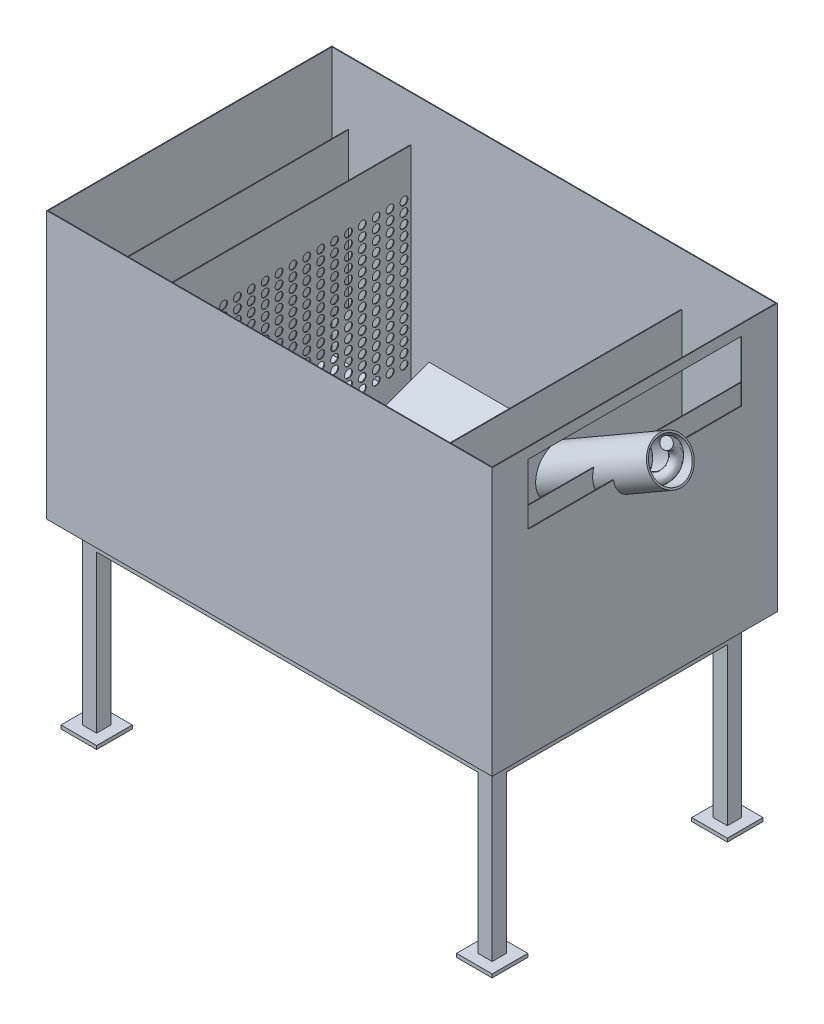
from build123d import *

# Parameters (mm, degrees)
MASTER_FOOTPRINT_W                       = 1250
MASTER_FOOTPRINT_H                       = 800.0000000000001
BATH_BASE_PLATE_DEPTH                    = 750
BATH_SHELL_2MM_T                         = -2
SKETCH_1_R                               = 50.00000000000001
INLET_D100_OPENING_DEPTH                 = 10
INLET_IMPACT_BAFFLE_START                = 125
SKETCH_2_W                               = 640.0000000000001
SKETCH_2_H                               = 430
INLET_IMPACT_BAFFLE_DEPTH                = 2
DISTRIBUTOR_D22_START                    = 250
SKETCH_3_W                               = 740
SKETCH_3_H                               = 648
SKETCH_3_R                               = 11.000000000000004
SKETCH_3_R_2                             = 10.999999999999996
SKETCH_3_R_3                             = 11.00000000000001
DISTRIBUTOR_D22_DEPTH                    = 2
OUTLET_SUBMERGED_BAFFLE_START            = 1030
SKETCH_4_W                               = 700
SKETCH_4_H                               = 330
OUTLET_SUBMERGED_BAFFLE_DEPTH            = 2
OVERFLOW_WEIR_Z550_START                 = 1190
SKETCH_5_W                               = 790.0000000000001
SKETCH_5_H                               = 548
OVERFLOW_WEIR_Z550_DEPTH                 = 2
OUTLET_WEIR_SLOT_W600_START              = 1245
SKETCH_6_W                               = 600
SKETCH_6_H                               = 170
OUTLET_WEIR_SLOT_W600_DEPTH              = 10
SLOPED_SEDIMENT_FLOOR_START              = 275
SLOPED_SEDIMENT_FLOOR_DEPTH              = 725
SKETCH_8_W                               = 39.99999999999999
SKETCH_8_H                               = 39.99999999999999
SKETCH_8_H_2                             = 39.999999999999886
SKETCH_8_W_2                             = 40
FRAME_LEGS_40X40_H500_DEPTH              = 500
FRAME_LONGITUDINAL_RAILS_START           = -20
SKETCH_9_W                               = 1150
SKETCH_9_H                               = 39.99999999999999
SKETCH_9_H_2                             = 39.999999999999886
FRAME_LONGITUDINAL_RAILS_DEPTH           = 40
FRAME_TRANSVERSE_RAILS_START             = -20
SKETCH_10_W                              = 39.99999999999999
SKETCH_10_H                              = 620.0000000000001
SKETCH_10_W_2                            = 40
FRAME_TRANSVERSE_RAILS_DEPTH             = 40
FRAME_FOOT_PADS_100X100_START            = -500
SKETCH_11_W                              = 100.00000000000001
SKETCH_11_H                              = 100.00000000000001
SKETCH_11_H_2                            = 100
SKETCH_11_W_2                            = 100
FRAME_FOOT_PADS_100X100_DEPTH            = 10
SCREW_PASSAGE_D120_PROFILE_R             = 60
SCREW_CASING_ID110_T5_PROFILE_R          = 60
SCREW_CASING_ID110_T5_PROFILE_R_2        = 55
SHAFTLESS_ROUND_COIL_D100_P100_PROFILE_R = 15


with BuildPart() as part:
    # MASTER_FOOTPRINT → BATH_BASE_PLATE (new body)
    with BuildSketch(Plane(origin=(0, 0, 0), x_dir=(1, 0, 0), z_dir=(0, 1, 0))):
        with Locations((625, 400.00000000000006)):
            Rectangle(MASTER_FOOTPRINT_W, MASTER_FOOTPRINT_H)
    extrude(amount=BATH_BASE_PLATE_DEPTH)

    # BATH_SHELL_2MM
    bath_shell_2mm_openings = [part.faces().sort_by_distance(p)[0] for p in [
        (625, 750, -400),
    ]]
    offset(amount=BATH_SHELL_2MM_T, openings=bath_shell_2mm_openings, kind=Kind.INTERSECTION)

    # Эскиз1 → INLET_D100_OPENING (cut)
    with BuildSketch(Plane(origin=(0, 0, 0), x_dir=(0, 0, -1), z_dir=(1, 0, 0))):
        with Locations((400, 420)):
            Circle(SKETCH_1_R)
    extrude(amount=INLET_D100_OPENING_DEPTH, mode=Mode.SUBTRACT)

    # Эскиз6 → OUTLET_WEIR_SLOT_W600 (cut)
    with BuildSketch(Plane(origin=(0, 0, 0), x_dir=(0, 0, -1), z_dir=(1, 0, 0)).offset(OUTLET_WEIR_SLOT_W600_START)):
        with Locations((400, 635)):
            Rectangle(SKETCH_6_W, SKETCH_6_H)
    extrude(amount=OUTLET_WEIR_SLOT_W600_DEPTH, mode=Mode.SUBTRACT)

    # Эскиз7 → SLOPED_SEDIMENT_FLOOR (add)
    with BuildSketch(Plane(origin=(0, 0, 0), x_dir=(0, 0, -1), z_dir=(1, 0, 0)).offset(SLOPED_SEDIMENT_FLOOR_START)):
        Polygon((2, -1), (2, 120), (330, -1), align=None)
        Polygon((798, -1), (798, 120), (470.00000000000006, -1), align=None)
    extrude(amount=SLOPED_SEDIMENT_FLOOR_DEPTH)

    # Эскиз8 → FRAME_LEGS_40X40_H500 (add)
    with BuildSketch(Plane(origin=(0, 0, 0), x_dir=(1, 0, 0), z_dir=(0, 1, 0))):
        with Locations((70, 70)):
            Rectangle(SKETCH_8_W, SKETCH_8_H)
        with Locations((70, 730)):
            Rectangle(SKETCH_8_W, SKETCH_8_H_2)
        with Locations((1180, 70)):
            Rectangle(SKETCH_8_W_2, SKETCH_8_H)
        with Locations((1180, 730)):
            Rectangle(SKETCH_8_W_2, SKETCH_8_H_2)
    extrude(amount=-FRAME_LEGS_40X40_H500_DEPTH)

    # Эскиз9 → FRAME_LONGITUDINAL_RAILS (add)
    with BuildSketch(Plane(origin=(0, 0, 0), x_dir=(1, 0, 0), z_dir=(0, 1, 0)).offset(FRAME_LONGITUDINAL_RAILS_START)):
        with Locations((625, 70)):
            Rectangle(SKETCH_9_W, SKETCH_9_H)
        with Locations((625, 730)):
            Rectangle(SKETCH_9_W, SKETCH_9_H_2)
    extrude(amount=-FRAME_LONGITUDINAL_RAILS_DEPTH)

    # Эскиз10 → FRAME_TRANSVERSE_RAILS (add)
    with BuildSketch(Plane(origin=(0, 0, 0), x_dir=(1, 0, 0), z_dir=(0, 1, 0)).offset(FRAME_TRANSVERSE_RAILS_START)):
        with Locations((70, 400.00000000000006)):
            Rectangle(SKETCH_10_W, SKETCH_10_H)
        with Locations((1180, 400.00000000000006)):
            Rectangle(SKETCH_10_W_2, SKETCH_10_H)
    extrude(amount=-FRAME_TRANSVERSE_RAILS_DEPTH)

    # Эскиз11 → FRAME_FOOT_PADS_100X100 (add)
    with BuildSketch(Plane(origin=(0, 0, 0), x_dir=(1, 0, 0), z_dir=(0, 1, 0)).offset(FRAME_FOOT_PADS_100X100_START)):
        with Locations((70, 70)):
            Rectangle(SKETCH_11_W, SKETCH_11_H)
        with Locations((70, 730)):
            Rectangle(SKETCH_11_W, SKETCH_11_H_2)
        with Locations((1180, 70)):
            Rectangle(SKETCH_11_W_2, SKETCH_11_H)
        with Locations((1180, 730)):
            Rectangle(SKETCH_11_W_2, SKETCH_11_H_2)
    extrude(amount=-FRAME_FOOT_PADS_100X100_DEPTH)


with BuildPart() as body_2:
    # Эскиз2 → INLET_IMPACT_BAFFLE (new body)
    with BuildSketch(Plane(origin=(0, 0, 0), x_dir=(0, 0, -1), z_dir=(1, 0, 0)).offset(INLET_IMPACT_BAFFLE_START)):
        with Locations((400.00000000000006, 435)):
            Rectangle(SKETCH_2_W, SKETCH_2_H)
    extrude(amount=INLET_IMPACT_BAFFLE_DEPTH)


with BuildPart() as body_3:
    # Эскиз3 → DISTRIBUTOR_D22 (new body)
    with BuildSketch(Plane(origin=(0, 0, 0), x_dir=(0, 0, -1), z_dir=(1, 0, 0)).offset(DISTRIBUTOR_D22_START)):
        with Locations((400, 326)):
            Rectangle(SKETCH_3_W, SKETCH_3_H)
        with Locations((49.473684210526315, 125)):
            Circle(SKETCH_3_R, mode=Mode.SUBTRACT)
        with Locations((49.473684210526315, 153.5)):
            Circle(SKETCH_3_R, mode=Mode.SUBTRACT)
        with Locations((49.473684210526315, 182)):
            Circle(SKETCH_3_R, mode=Mode.SUBTRACT)
        with Locations((49.473684210526315, 210.50000000000003)):
            Circle(SKETCH_3_R, mode=Mode.SUBTRACT)
        with Locations((49.473684210526315, 239)):
            Circle(SKETCH_3_R, mode=Mode.SUBTRACT)
        with Locations((49.473684210526315, 267.5)):
            Circle(SKETCH_3_R, mode=Mode.SUBTRACT)
        with Locations((49.473684210526315, 296.00000000000006)):
            Circle(SKETCH_3_R, mode=Mode.SUBTRACT)
        with Locations((49.473684210526315, 324.5)):
            Circle(SKETCH_3_R, mode=Mode.SUBTRACT)
        with Locations((49.473684210526315, 353)):
            Circle(SKETCH_3_R, mode=Mode.SUBTRACT)
        with Locations((49.473684210526315, 381.5)):
            Circle(SKETCH_3_R, mode=Mode.SUBTRACT)
        with Locations((49.473684210526315, 410.00000000000006)):
            Circle(SKETCH_3_R, mode=Mode.SUBTRACT)
        with Locations((49.473684210526315, 438.5)):
            Circle(SKETCH_3_R, mode=Mode.SUBTRACT)
        with Locations((49.473684210526315, 467)):
            Circle(SKETCH_3_R, mode=Mode.SUBTRACT)
        with Locations((49.473684210526315, 495.5)):
            Circle(SKETCH_3_R, mode=Mode.SUBTRACT)
        with Locations((49.473684210526315, 524)):
            Circle(SKETCH_3_R, mode=Mode.SUBTRACT)
        with Locations((88.42105263157895, 125)):
            Circle(SKETCH_3_R_2, mode=Mode.SUBTRACT)
        with Locations((88.42105263157895, 153.5)):
            Circle(SKETCH_3_R_2, mode=Mode.SUBTRACT)
        with Locations((88.42105263157895, 182)):
            Circle(SKETCH_3_R_2, mode=Mode.SUBTRACT)
        with Locations((88.42105263157895, 210.50000000000003)):
            Circle(SKETCH_3_R_2, mode=Mode.SUBTRACT)
        with Locations((88.42105263157895, 239)):
            Circle(SKETCH_3_R_2, mode=Mode.SUBTRACT)
        with Locations((88.42105263157895, 267.5)):
            Circle(SKETCH_3_R_2, mode=Mode.SUBTRACT)
        with Locations((88.42105263157895, 296.00000000000006)):
            Circle(SKETCH_3_R_2, mode=Mode.SUBTRACT)
        with Locations((88.42105263157895, 324.5)):
            Circle(SKETCH_3_R_2, mode=Mode.SUBTRACT)
        with Locations((88.42105263157895, 353)):
            Circle(SKETCH_3_R_2, mode=Mode.SUBTRACT)
        with Locations((88.42105263157895, 381.5)):
            Circle(SKETCH_3_R_2, mode=Mode.SUBTRACT)
        with Locations((88.42105263157895, 410.00000000000006)):
            Circle(SKETCH_3_R_2, mode=Mode.SUBTRACT)
        with Locations((88.42105263157895, 438.5)):
            Circle(SKETCH_3_R_2, mode=Mode.SUBTRACT)
        with Locations((88.42105263157895, 467)):
            Circle(SKETCH_3_R_2, mode=Mode.SUBTRACT)
        with Locations((88.42105263157895, 495.5)):
            Circle(SKETCH_3_R_2, mode=Mode.SUBTRACT)
        with Locations((88.42105263157895, 524)):
            Circle(SKETCH_3_R_2, mode=Mode.SUBTRACT)
        with Locations((127.36842105263158, 125)):
            Circle(SKETCH_3_R_3, mode=Mode.SUBTRACT)
        with Locations((127.36842105263158, 153.5)):
            Circle(SKETCH_3_R_3, mode=Mode.SUBTRACT)
        with Locations((127.36842105263158, 182)):
            Circle(SKETCH_3_R_3, mode=Mode.SUBTRACT)
        with Locations((127.36842105263158, 210.50000000000003)):
            Circle(SKETCH_3_R_3, mode=Mode.SUBTRACT)
        with Locations((127.36842105263158, 239)):
            Circle(SKETCH_3_R_3, mode=Mode.SUBTRACT)
        with Locations((127.36842105263158, 267.5)):
            Circle(SKETCH_3_R_3, mode=Mode.SUBTRACT)
        with Locations((127.36842105263158, 296.00000000000006)):
            Circle(SKETCH_3_R_3, mode=Mode.SUBTRACT)
        with Locations((127.36842105263158, 324.5)):
            Circle(SKETCH_3_R_3, mode=Mode.SUBTRACT)
        with Locations((127.36842105263158, 353)):
            Circle(SKETCH_3_R_3, mode=Mode.SUBTRACT)
        with Locations((127.36842105263158, 381.5)):
            Circle(SKETCH_3_R_3, mode=Mode.SUBTRACT)
        with Locations((127.36842105263158, 410.00000000000006)):
            Circle(SKETCH_3_R_3, mode=Mode.SUBTRACT)
        with Locations((127.36842105263158, 438.5)):
            Circle(SKETCH_3_R_3, mode=Mode.SUBTRACT)
        with Locations((127.36842105263158, 467)):
            Circle(SKETCH_3_R_3, mode=Mode.SUBTRACT)
        with Locations((127.36842105263158, 495.5)):
            Circle(SKETCH_3_R_3, mode=Mode.SUBTRACT)
        with Locations((127.36842105263158, 524)):
            Circle(SKETCH_3_R_3, mode=Mode.SUBTRACT)
        with Locations((166.3157894736842, 125)):
            Circle(SKETCH_3_R_3, mode=Mode.SUBTRACT)
        with Locations((166.3157894736842, 153.5)):
            Circle(SKETCH_3_R_3, mode=Mode.SUBTRACT)
        with Locations((166.3157894736842, 182)):
            Circle(SKETCH_3_R_3, mode=Mode.SUBTRACT)
        with Locations((166.3157894736842, 210.50000000000003)):
            Circle(SKETCH_3_R_3, mode=Mode.SUBTRACT)
        with Locations((166.3157894736842, 239)):
            Circle(SKETCH_3_R_3, mode=Mode.SUBTRACT)
        with Locations((166.3157894736842, 267.5)):
            Circle(SKETCH_3_R_3, mode=Mode.SUBTRACT)
        with Locations((166.3157894736842, 296.00000000000006)):
            Circle(SKETCH_3_R_3, mode=Mode.SUBTRACT)
        with Locations((166.3157894736842, 324.5)):
            Circle(SKETCH_3_R_3, mode=Mode.SUBTRACT)
        with Locations((166.3157894736842, 353)):
            Circle(SKETCH_3_R_3, mode=Mode.SUBTRACT)
        with Locations((166.3157894736842, 381.5)):
            Circle(SKETCH_3_R_3, mode=Mode.SUBTRACT)
        with Locations((166.3157894736842, 410.00000000000006)):
            Circle(SKETCH_3_R_3, mode=Mode.SUBTRACT)
        with Locations((166.3157894736842, 438.5)):
            Circle(SKETCH_3_R_3, mode=Mode.SUBTRACT)
        with Locations((166.3157894736842, 467)):
            Circle(SKETCH_3_R_3, mode=Mode.SUBTRACT)
        with Locations((166.3157894736842, 495.5)):
            Circle(SKETCH_3_R_3, mode=Mode.SUBTRACT)
        with Locations((166.3157894736842, 524)):
            Circle(SKETCH_3_R_3, mode=Mode.SUBTRACT)
        with Locations((205.26315789473685, 125)):
            Circle(SKETCH_3_R_3, mode=Mode.SUBTRACT)
        with Locations((205.26315789473685, 153.5)):
            Circle(SKETCH_3_R_3, mode=Mode.SUBTRACT)
        with Locations((205.26315789473685, 182)):
            Circle(SKETCH_3_R_3, mode=Mode.SUBTRACT)
        with Locations((205.26315789473685, 210.50000000000003)):
            Circle(SKETCH_3_R_3, mode=Mode.SUBTRACT)
        with Locations((205.26315789473685, 239)):
            Circle(SKETCH_3_R_3, mode=Mode.SUBTRACT)
        with Locations((205.26315789473685, 267.5)):
            Circle(SKETCH_3_R_3, mode=Mode.SUBTRACT)
        with Locations((205.26315789473685, 296.00000000000006)):
            Circle(SKETCH_3_R_3, mode=Mode.SUBTRACT)
        with Locations((205.26315789473685, 324.5)):
            Circle(SKETCH_3_R_3, mode=Mode.SUBTRACT)
        with Locations((205.26315789473685, 353)):
            Circle(SKETCH_3_R_3, mode=Mode.SUBTRACT)
        with Locations((205.26315789473685, 381.5)):
            Circle(SKETCH_3_R_3, mode=Mode.SUBTRACT)
        with Locations((205.26315789473685, 410.00000000000006)):
            Circle(SKETCH_3_R_3, mode=Mode.SUBTRACT)
        with Locations((205.26315789473685, 438.5)):
            Circle(SKETCH_3_R_3, mode=Mode.SUBTRACT)
        with Locations((205.26315789473685, 467)):
            Circle(SKETCH_3_R_3, mode=Mode.SUBTRACT)
        with Locations((205.26315789473685, 495.5)):
            Circle(SKETCH_3_R_3, mode=Mode.SUBTRACT)
        with Locations((205.26315789473685, 524)):
            Circle(SKETCH_3_R_3, mode=Mode.SUBTRACT)
        with Locations((244.21052631578948, 125)):
            Circle(SKETCH_3_R_3, mode=Mode.SUBTRACT)
        with Locations((244.21052631578948, 153.5)):
            Circle(SKETCH_3_R_3, mode=Mode.SUBTRACT)
        with Locations((244.21052631578948, 182)):
            Circle(SKETCH_3_R_3, mode=Mode.SUBTRACT)
        with Locations((244.21052631578948, 210.50000000000003)):
            Circle(SKETCH_3_R_3, mode=Mode.SUBTRACT)
        with Locations((244.21052631578948, 239)):
            Circle(SKETCH_3_R_3, mode=Mode.SUBTRACT)
        with Locations((244.21052631578948, 267.5)):
            Circle(SKETCH_3_R_3, mode=Mode.SUBTRACT)
        with Locations((244.21052631578948, 296.00000000000006)):
            Circle(SKETCH_3_R_3, mode=Mode.SUBTRACT)
        with Locations((244.21052631578948, 324.5)):
            Circle(SKETCH_3_R_3, mode=Mode.SUBTRACT)
        with Locations((244.21052631578948, 353)):
            Circle(SKETCH_3_R_3, mode=Mode.SUBTRACT)
        with Locations((244.21052631578948, 381.5)):
            Circle(SKETCH_3_R_3, mode=Mode.SUBTRACT)
        with Locations((244.21052631578948, 410.00000000000006)):
            Circle(SKETCH_3_R_3, mode=Mode.SUBTRACT)
        with Locations((244.21052631578948, 438.5)):
            Circle(SKETCH_3_R_3, mode=Mode.SUBTRACT)
        with Locations((244.21052631578948, 467)):
            Circle(SKETCH_3_R_3, mode=Mode.SUBTRACT)
        with Locations((244.21052631578948, 495.5)):
            Circle(SKETCH_3_R_3, mode=Mode.SUBTRACT)
        with Locations((244.21052631578948, 524)):
            Circle(SKETCH_3_R_3, mode=Mode.SUBTRACT)
        with Locations((283.1578947368421, 125)):
            Circle(SKETCH_3_R_3, mode=Mode.SUBTRACT)
        with Locations((283.1578947368421, 153.5)):
            Circle(SKETCH_3_R_3, mode=Mode.SUBTRACT)
        with Locations((283.1578947368421, 182)):
            Circle(SKETCH_3_R_3, mode=Mode.SUBTRACT)
        with Locations((283.1578947368421, 210.50000000000003)):
            Circle(SKETCH_3_R_3, mode=Mode.SUBTRACT)
        with Locations((283.1578947368421, 239)):
            Circle(SKETCH_3_R_3, mode=Mode.SUBTRACT)
        with Locations((283.1578947368421, 267.5)):
            Circle(SKETCH_3_R_3, mode=Mode.SUBTRACT)
        with Locations((283.1578947368421, 296.00000000000006)):
            Circle(SKETCH_3_R_3, mode=Mode.SUBTRACT)
        with Locations((283.1578947368421, 324.5)):
            Circle(SKETCH_3_R_3, mode=Mode.SUBTRACT)
        with Locations((283.1578947368421, 353)):
            Circle(SKETCH_3_R_3, mode=Mode.SUBTRACT)
        with Locations((283.1578947368421, 381.5)):
            Circle(SKETCH_3_R_3, mode=Mode.SUBTRACT)
        with Locations((283.1578947368421, 410.00000000000006)):
            Circle(SKETCH_3_R_3, mode=Mode.SUBTRACT)
        with Locations((283.1578947368421, 438.5)):
            Circle(SKETCH_3_R_3, mode=Mode.SUBTRACT)
        with Locations((283.1578947368421, 467)):
            Circle(SKETCH_3_R_3, mode=Mode.SUBTRACT)
        with Locations((283.1578947368421, 495.5)):
            Circle(SKETCH_3_R_3, mode=Mode.SUBTRACT)
        with Locations((283.1578947368421, 524)):
            Circle(SKETCH_3_R_3, mode=Mode.SUBTRACT)
        with Locations((322.1052631578947, 125)):
            Circle(SKETCH_3_R_3, mode=Mode.SUBTRACT)
        with Locations((322.1052631578947, 153.5)):
            Circle(SKETCH_3_R_3, mode=Mode.SUBTRACT)
        with Locations((322.1052631578947, 182)):
            Circle(SKETCH_3_R_3, mode=Mode.SUBTRACT)
        with Locations((322.1052631578947, 210.50000000000003)):
            Circle(SKETCH_3_R_3, mode=Mode.SUBTRACT)
        with Locations((322.1052631578947, 239)):
            Circle(SKETCH_3_R_3, mode=Mode.SUBTRACT)
        with Locations((322.1052631578947, 267.5)):
            Circle(SKETCH_3_R_3, mode=Mode.SUBTRACT)
        with Locations((322.1052631578947, 296.00000000000006)):
            Circle(SKETCH_3_R_3, mode=Mode.SUBTRACT)
        with Locations((322.1052631578947, 324.5)):
            Circle(SKETCH_3_R_3, mode=Mode.SUBTRACT)
        with Locations((322.1052631578947, 353)):
            Circle(SKETCH_3_R_3, mode=Mode.SUBTRACT)
        with Locations((322.1052631578947, 381.5)):
            Circle(SKETCH_3_R_3, mode=Mode.SUBTRACT)
        with Locations((322.1052631578947, 410.00000000000006)):
            Circle(SKETCH_3_R_3, mode=Mode.SUBTRACT)
        with Locations((322.1052631578947, 438.5)):
            Circle(SKETCH_3_R_3, mode=Mode.SUBTRACT)
        with Locations((322.1052631578947, 467)):
            Circle(SKETCH_3_R_3, mode=Mode.SUBTRACT)
        with Locations((322.1052631578947, 495.5)):
            Circle(SKETCH_3_R_3, mode=Mode.SUBTRACT)
        with Locations((322.1052631578947, 524)):
            Circle(SKETCH_3_R_3, mode=Mode.SUBTRACT)
        with Locations((361.0526315789474, 125)):
            Circle(SKETCH_3_R_3, mode=Mode.SUBTRACT)
        with Locations((361.0526315789474, 153.5)):
            Circle(SKETCH_3_R_3, mode=Mode.SUBTRACT)
        with Locations((361.0526315789474, 182)):
            Circle(SKETCH_3_R_3, mode=Mode.SUBTRACT)
        with Locations((361.0526315789474, 210.50000000000003)):
            Circle(SKETCH_3_R_3, mode=Mode.SUBTRACT)
        with Locations((361.0526315789474, 239)):
            Circle(SKETCH_3_R_3, mode=Mode.SUBTRACT)
        with Locations((361.0526315789474, 267.5)):
            Circle(SKETCH_3_R_3, mode=Mode.SUBTRACT)
        with Locations((361.0526315789474, 296.00000000000006)):
            Circle(SKETCH_3_R_3, mode=Mode.SUBTRACT)
        with Locations((361.0526315789474, 324.5)):
            Circle(SKETCH_3_R_3, mode=Mode.SUBTRACT)
        with Locations((361.0526315789474, 353)):
            Circle(SKETCH_3_R_3, mode=Mode.SUBTRACT)
        with Locations((361.0526315789474, 381.5)):
            Circle(SKETCH_3_R_3, mode=Mode.SUBTRACT)
        with Locations((361.0526315789474, 410.00000000000006)):
            Circle(SKETCH_3_R_3, mode=Mode.SUBTRACT)
        with Locations((361.0526315789474, 438.5)):
            Circle(SKETCH_3_R_3, mode=Mode.SUBTRACT)
        with Locations((361.0526315789474, 467)):
            Circle(SKETCH_3_R_3, mode=Mode.SUBTRACT)
        with Locations((361.0526315789474, 495.5)):
            Circle(SKETCH_3_R_3, mode=Mode.SUBTRACT)
        with Locations((361.0526315789474, 524)):
            Circle(SKETCH_3_R_3, mode=Mode.SUBTRACT)
        with Locations((400, 125)):
            Circle(SKETCH_3_R_3, mode=Mode.SUBTRACT)
        with Locations((400, 153.5)):
            Circle(SKETCH_3_R_3, mode=Mode.SUBTRACT)
        with Locations((400, 182)):
            Circle(SKETCH_3_R_3, mode=Mode.SUBTRACT)
        with Locations((400, 210.50000000000003)):
            Circle(SKETCH_3_R_3, mode=Mode.SUBTRACT)
        with Locations((400, 239)):
            Circle(SKETCH_3_R_3, mode=Mode.SUBTRACT)
        with Locations((400, 267.5)):
            Circle(SKETCH_3_R_3, mode=Mode.SUBTRACT)
        with Locations((400, 296.00000000000006)):
            Circle(SKETCH_3_R_3, mode=Mode.SUBTRACT)
        with Locations((400, 324.5)):
            Circle(SKETCH_3_R_3, mode=Mode.SUBTRACT)
        with Locations((400, 353)):
            Circle(SKETCH_3_R_3, mode=Mode.SUBTRACT)
        with Locations((400, 381.5)):
            Circle(SKETCH_3_R_3, mode=Mode.SUBTRACT)
        with Locations((400, 410.00000000000006)):
            Circle(SKETCH_3_R_3, mode=Mode.SUBTRACT)
        with Locations((400, 438.5)):
            Circle(SKETCH_3_R_3, mode=Mode.SUBTRACT)
        with Locations((400, 467)):
            Circle(SKETCH_3_R_3, mode=Mode.SUBTRACT)
        with Locations((400, 495.5)):
            Circle(SKETCH_3_R_3, mode=Mode.SUBTRACT)
        with Locations((400, 524)):
            Circle(SKETCH_3_R_3, mode=Mode.SUBTRACT)
        with Locations((438.94736842105266, 125)):
            Circle(SKETCH_3_R_3, mode=Mode.SUBTRACT)
        with Locations((438.94736842105266, 153.5)):
            Circle(SKETCH_3_R_3, mode=Mode.SUBTRACT)
        with Locations((438.94736842105266, 182)):
            Circle(SKETCH_3_R_3, mode=Mode.SUBTRACT)
        with Locations((438.94736842105266, 210.50000000000003)):
            Circle(SKETCH_3_R_3, mode=Mode.SUBTRACT)
        with Locations((438.94736842105266, 239)):
            Circle(SKETCH_3_R_3, mode=Mode.SUBTRACT)
        with Locations((438.94736842105266, 267.5)):
            Circle(SKETCH_3_R_3, mode=Mode.SUBTRACT)
        with Locations((438.94736842105266, 296.00000000000006)):
            Circle(SKETCH_3_R_3, mode=Mode.SUBTRACT)
        with Locations((438.94736842105266, 324.5)):
            Circle(SKETCH_3_R_3, mode=Mode.SUBTRACT)
        with Locations((438.94736842105266, 353)):
            Circle(SKETCH_3_R_3, mode=Mode.SUBTRACT)
        with Locations((438.94736842105266, 381.5)):
            Circle(SKETCH_3_R_3, mode=Mode.SUBTRACT)
        with Locations((438.94736842105266, 410.00000000000006)):
            Circle(SKETCH_3_R_3, mode=Mode.SUBTRACT)
        with Locations((438.94736842105266, 438.5)):
            Circle(SKETCH_3_R_3, mode=Mode.SUBTRACT)
        with Locations((438.94736842105266, 467)):
            Circle(SKETCH_3_R_3, mode=Mode.SUBTRACT)
        with Locations((438.94736842105266, 495.5)):
            Circle(SKETCH_3_R_3, mode=Mode.SUBTRACT)
        with Locations((438.94736842105266, 524)):
            Circle(SKETCH_3_R_3, mode=Mode.SUBTRACT)
        with Locations((477.89473684210526, 125)):
            Circle(SKETCH_3_R_3, mode=Mode.SUBTRACT)
        with Locations((477.89473684210526, 153.5)):
            Circle(SKETCH_3_R_3, mode=Mode.SUBTRACT)
        with Locations((477.89473684210526, 182)):
            Circle(SKETCH_3_R_3, mode=Mode.SUBTRACT)
        with Locations((477.89473684210526, 210.50000000000003)):
            Circle(SKETCH_3_R_3, mode=Mode.SUBTRACT)
        with Locations((477.89473684210526, 239)):
            Circle(SKETCH_3_R_3, mode=Mode.SUBTRACT)
        with Locations((477.89473684210526, 267.5)):
            Circle(SKETCH_3_R_3, mode=Mode.SUBTRACT)
        with Locations((477.89473684210526, 296.00000000000006)):
            Circle(SKETCH_3_R_3, mode=Mode.SUBTRACT)
        with Locations((477.89473684210526, 324.5)):
            Circle(SKETCH_3_R_3, mode=Mode.SUBTRACT)
        with Locations((477.89473684210526, 353)):
            Circle(SKETCH_3_R_3, mode=Mode.SUBTRACT)
        with Locations((477.89473684210526, 381.5)):
            Circle(SKETCH_3_R_3, mode=Mode.SUBTRACT)
        with Locations((477.89473684210526, 410.00000000000006)):
            Circle(SKETCH_3_R_3, mode=Mode.SUBTRACT)
        with Locations((477.89473684210526, 438.5)):
            Circle(SKETCH_3_R_3, mode=Mode.SUBTRACT)
        with Locations((477.89473684210526, 467)):
            Circle(SKETCH_3_R_3, mode=Mode.SUBTRACT)
        with Locations((477.89473684210526, 495.5)):
            Circle(SKETCH_3_R_3, mode=Mode.SUBTRACT)
        with Locations((477.89473684210526, 524)):
            Circle(SKETCH_3_R_3, mode=Mode.SUBTRACT)
        with Locations((516.8421052631579, 125)):
            Circle(SKETCH_3_R_3, mode=Mode.SUBTRACT)
        with Locations((516.8421052631579, 153.5)):
            Circle(SKETCH_3_R_3, mode=Mode.SUBTRACT)
        with Locations((516.8421052631579, 182)):
            Circle(SKETCH_3_R_3, mode=Mode.SUBTRACT)
        with Locations((516.8421052631579, 210.50000000000003)):
            Circle(SKETCH_3_R_3, mode=Mode.SUBTRACT)
        with Locations((516.8421052631579, 239)):
            Circle(SKETCH_3_R_3, mode=Mode.SUBTRACT)
        with Locations((516.8421052631579, 267.5)):
            Circle(SKETCH_3_R_3, mode=Mode.SUBTRACT)
        with Locations((516.8421052631579, 296.00000000000006)):
            Circle(SKETCH_3_R_3, mode=Mode.SUBTRACT)
        with Locations((516.8421052631579, 324.5)):
            Circle(SKETCH_3_R_3, mode=Mode.SUBTRACT)
        with Locations((516.8421052631579, 353)):
            Circle(SKETCH_3_R_3, mode=Mode.SUBTRACT)
        with Locations((516.8421052631579, 381.5)):
            Circle(SKETCH_3_R_3, mode=Mode.SUBTRACT)
        with Locations((516.8421052631579, 410.00000000000006)):
            Circle(SKETCH_3_R_3, mode=Mode.SUBTRACT)
        with Locations((516.8421052631579, 438.5)):
            Circle(SKETCH_3_R_3, mode=Mode.SUBTRACT)
        with Locations((516.8421052631579, 467)):
            Circle(SKETCH_3_R_3, mode=Mode.SUBTRACT)
        with Locations((516.8421052631579, 495.5)):
            Circle(SKETCH_3_R_3, mode=Mode.SUBTRACT)
        with Locations((516.8421052631579, 524)):
            Circle(SKETCH_3_R_3, mode=Mode.SUBTRACT)
        with Locations((555.7894736842106, 125)):
            Circle(SKETCH_3_R_3, mode=Mode.SUBTRACT)
        with Locations((555.7894736842106, 153.5)):
            Circle(SKETCH_3_R_3, mode=Mode.SUBTRACT)
        with Locations((555.7894736842106, 182)):
            Circle(SKETCH_3_R_3, mode=Mode.SUBTRACT)
        with Locations((555.7894736842106, 210.50000000000003)):
            Circle(SKETCH_3_R_3, mode=Mode.SUBTRACT)
        with Locations((555.7894736842106, 239)):
            Circle(SKETCH_3_R_3, mode=Mode.SUBTRACT)
        with Locations((555.7894736842106, 267.5)):
            Circle(SKETCH_3_R_3, mode=Mode.SUBTRACT)
        with Locations((555.7894736842106, 296.00000000000006)):
            Circle(SKETCH_3_R_3, mode=Mode.SUBTRACT)
        with Locations((555.7894736842106, 324.5)):
            Circle(SKETCH_3_R_3, mode=Mode.SUBTRACT)
        with Locations((555.7894736842106, 353)):
            Circle(SKETCH_3_R_3, mode=Mode.SUBTRACT)
        with Locations((555.7894736842106, 381.5)):
            Circle(SKETCH_3_R_3, mode=Mode.SUBTRACT)
        with Locations((555.7894736842106, 410.00000000000006)):
            Circle(SKETCH_3_R_3, mode=Mode.SUBTRACT)
        with Locations((555.7894736842106, 438.5)):
            Circle(SKETCH_3_R_3, mode=Mode.SUBTRACT)
        with Locations((555.7894736842106, 467)):
            Circle(SKETCH_3_R_3, mode=Mode.SUBTRACT)
        with Locations((555.7894736842106, 495.5)):
            Circle(SKETCH_3_R_3, mode=Mode.SUBTRACT)
        with Locations((555.7894736842106, 524)):
            Circle(SKETCH_3_R_3, mode=Mode.SUBTRACT)
        with Locations((594.7368421052632, 125)):
            Circle(SKETCH_3_R_3, mode=Mode.SUBTRACT)
        with Locations((594.7368421052632, 153.5)):
            Circle(SKETCH_3_R_3, mode=Mode.SUBTRACT)
        with Locations((594.7368421052632, 182)):
            Circle(SKETCH_3_R_3, mode=Mode.SUBTRACT)
        with Locations((594.7368421052632, 210.50000000000003)):
            Circle(SKETCH_3_R_3, mode=Mode.SUBTRACT)
        with Locations((594.7368421052632, 239)):
            Circle(SKETCH_3_R_3, mode=Mode.SUBTRACT)
        with Locations((594.7368421052632, 267.5)):
            Circle(SKETCH_3_R_3, mode=Mode.SUBTRACT)
        with Locations((594.7368421052632, 296.00000000000006)):
            Circle(SKETCH_3_R_3, mode=Mode.SUBTRACT)
        with Locations((594.7368421052632, 324.5)):
            Circle(SKETCH_3_R_3, mode=Mode.SUBTRACT)
        with Locations((594.7368421052632, 353)):
            Circle(SKETCH_3_R_3, mode=Mode.SUBTRACT)
        with Locations((594.7368421052632, 381.5)):
            Circle(SKETCH_3_R_3, mode=Mode.SUBTRACT)
        with Locations((594.7368421052632, 410.00000000000006)):
            Circle(SKETCH_3_R_3, mode=Mode.SUBTRACT)
        with Locations((594.7368421052632, 438.5)):
            Circle(SKETCH_3_R_3, mode=Mode.SUBTRACT)
        with Locations((594.7368421052632, 467)):
            Circle(SKETCH_3_R_3, mode=Mode.SUBTRACT)
        with Locations((594.7368421052632, 495.5)):
            Circle(SKETCH_3_R_3, mode=Mode.SUBTRACT)
        with Locations((594.7368421052632, 524)):
            Circle(SKETCH_3_R_3, mode=Mode.SUBTRACT)
        with Locations((633.6842105263158, 125)):
            Circle(SKETCH_3_R_3, mode=Mode.SUBTRACT)
        with Locations((633.6842105263158, 153.5)):
            Circle(SKETCH_3_R_3, mode=Mode.SUBTRACT)
        with Locations((633.6842105263158, 182)):
            Circle(SKETCH_3_R_3, mode=Mode.SUBTRACT)
        with Locations((633.6842105263158, 210.50000000000003)):
            Circle(SKETCH_3_R_3, mode=Mode.SUBTRACT)
        with Locations((633.6842105263158, 239)):
            Circle(SKETCH_3_R_3, mode=Mode.SUBTRACT)
        with Locations((633.6842105263158, 267.5)):
            Circle(SKETCH_3_R_3, mode=Mode.SUBTRACT)
        with Locations((633.6842105263158, 296.00000000000006)):
            Circle(SKETCH_3_R_3, mode=Mode.SUBTRACT)
        with Locations((633.6842105263158, 324.5)):
            Circle(SKETCH_3_R_3, mode=Mode.SUBTRACT)
        with Locations((633.6842105263158, 353)):
            Circle(SKETCH_3_R_3, mode=Mode.SUBTRACT)
        with Locations((633.6842105263158, 381.5)):
            Circle(SKETCH_3_R_3, mode=Mode.SUBTRACT)
        with Locations((633.6842105263158, 410.00000000000006)):
            Circle(SKETCH_3_R_3, mode=Mode.SUBTRACT)
        with Locations((633.6842105263158, 438.5)):
            Circle(SKETCH_3_R_3, mode=Mode.SUBTRACT)
        with Locations((633.6842105263158, 467)):
            Circle(SKETCH_3_R_3, mode=Mode.SUBTRACT)
        with Locations((633.6842105263158, 495.5)):
            Circle(SKETCH_3_R_3, mode=Mode.SUBTRACT)
        with Locations((633.6842105263158, 524)):
            Circle(SKETCH_3_R_3, mode=Mode.SUBTRACT)
        with Locations((672.6315789473683, 125)):
            Circle(SKETCH_3_R_3, mode=Mode.SUBTRACT)
        with Locations((672.6315789473683, 153.5)):
            Circle(SKETCH_3_R_3, mode=Mode.SUBTRACT)
        with Locations((672.6315789473683, 182)):
            Circle(SKETCH_3_R_3, mode=Mode.SUBTRACT)
        with Locations((672.6315789473683, 210.50000000000003)):
            Circle(SKETCH_3_R_3, mode=Mode.SUBTRACT)
        with Locations((672.6315789473683, 239)):
            Circle(SKETCH_3_R_3, mode=Mode.SUBTRACT)
        with Locations((672.6315789473683, 267.5)):
            Circle(SKETCH_3_R_3, mode=Mode.SUBTRACT)
        with Locations((672.6315789473683, 296.00000000000006)):
            Circle(SKETCH_3_R_3, mode=Mode.SUBTRACT)
        with Locations((672.6315789473683, 324.5)):
            Circle(SKETCH_3_R_3, mode=Mode.SUBTRACT)
        with Locations((672.6315789473683, 353)):
            Circle(SKETCH_3_R_3, mode=Mode.SUBTRACT)
        with Locations((672.6315789473683, 381.5)):
            Circle(SKETCH_3_R_3, mode=Mode.SUBTRACT)
        with Locations((672.6315789473683, 410.00000000000006)):
            Circle(SKETCH_3_R_3, mode=Mode.SUBTRACT)
        with Locations((672.6315789473683, 438.5)):
            Circle(SKETCH_3_R_3, mode=Mode.SUBTRACT)
        with Locations((672.6315789473683, 467)):
            Circle(SKETCH_3_R_3, mode=Mode.SUBTRACT)
        with Locations((672.6315789473683, 495.5)):
            Circle(SKETCH_3_R_3, mode=Mode.SUBTRACT)
        with Locations((672.6315789473683, 524)):
            Circle(SKETCH_3_R_3, mode=Mode.SUBTRACT)
        with Locations((711.578947368421, 125)):
            Circle(SKETCH_3_R_3, mode=Mode.SUBTRACT)
        with Locations((711.578947368421, 153.5)):
            Circle(SKETCH_3_R_3, mode=Mode.SUBTRACT)
        with Locations((711.578947368421, 182)):
            Circle(SKETCH_3_R_3, mode=Mode.SUBTRACT)
        with Locations((711.578947368421, 210.50000000000003)):
            Circle(SKETCH_3_R_3, mode=Mode.SUBTRACT)
        with Locations((711.578947368421, 239)):
            Circle(SKETCH_3_R_3, mode=Mode.SUBTRACT)
        with Locations((711.578947368421, 267.5)):
            Circle(SKETCH_3_R_3, mode=Mode.SUBTRACT)
        with Locations((711.578947368421, 296.00000000000006)):
            Circle(SKETCH_3_R_3, mode=Mode.SUBTRACT)
        with Locations((711.578947368421, 324.5)):
            Circle(SKETCH_3_R_3, mode=Mode.SUBTRACT)
        with Locations((711.578947368421, 353)):
            Circle(SKETCH_3_R_3, mode=Mode.SUBTRACT)
        with Locations((711.578947368421, 381.5)):
            Circle(SKETCH_3_R_3, mode=Mode.SUBTRACT)
        with Locations((711.578947368421, 410.00000000000006)):
            Circle(SKETCH_3_R_3, mode=Mode.SUBTRACT)
        with Locations((711.578947368421, 438.5)):
            Circle(SKETCH_3_R_3, mode=Mode.SUBTRACT)
        with Locations((711.578947368421, 467)):
            Circle(SKETCH_3_R_3, mode=Mode.SUBTRACT)
        with Locations((711.578947368421, 495.5)):
            Circle(SKETCH_3_R_3, mode=Mode.SUBTRACT)
        with Locations((711.578947368421, 524)):
            Circle(SKETCH_3_R_3, mode=Mode.SUBTRACT)
        with Locations((750.5263157894738, 125)):
            Circle(SKETCH_3_R_3, mode=Mode.SUBTRACT)
        with Locations((750.5263157894738, 153.5)):
            Circle(SKETCH_3_R_3, mode=Mode.SUBTRACT)
        with Locations((750.5263157894738, 182)):
            Circle(SKETCH_3_R_3, mode=Mode.SUBTRACT)
        with Locations((750.5263157894738, 210.50000000000003)):
            Circle(SKETCH_3_R_3, mode=Mode.SUBTRACT)
        with Locations((750.5263157894738, 239)):
            Circle(SKETCH_3_R_3, mode=Mode.SUBTRACT)
        with Locations((750.5263157894738, 267.5)):
            Circle(SKETCH_3_R_3, mode=Mode.SUBTRACT)
        with Locations((750.5263157894738, 296.00000000000006)):
            Circle(SKETCH_3_R_3, mode=Mode.SUBTRACT)
        with Locations((750.5263157894738, 324.5)):
            Circle(SKETCH_3_R_3, mode=Mode.SUBTRACT)
        with Locations((750.5263157894738, 353)):
            Circle(SKETCH_3_R_3, mode=Mode.SUBTRACT)
        with Locations((750.5263157894738, 381.5)):
            Circle(SKETCH_3_R_3, mode=Mode.SUBTRACT)
        with Locations((750.5263157894738, 410.00000000000006)):
            Circle(SKETCH_3_R_3, mode=Mode.SUBTRACT)
        with Locations((750.5263157894738, 438.5)):
            Circle(SKETCH_3_R_3, mode=Mode.SUBTRACT)
        with Locations((750.5263157894738, 467)):
            Circle(SKETCH_3_R_3, mode=Mode.SUBTRACT)
        with Locations((750.5263157894738, 495.5)):
            Circle(SKETCH_3_R_3, mode=Mode.SUBTRACT)
        with Locations((750.5263157894738, 524)):
            Circle(SKETCH_3_R_3, mode=Mode.SUBTRACT)
    extrude(amount=DISTRIBUTOR_D22_DEPTH)


with BuildPart() as body_4:
    # Эскиз4 → OUTLET_SUBMERGED_BAFFLE (new body)
    with BuildSketch(Plane(origin=(0, 0, 0), x_dir=(0, 0, -1), z_dir=(1, 0, 0)).offset(OUTLET_SUBMERGED_BAFFLE_START)):
        with Locations((400, 485)):
            Rectangle(SKETCH_4_W, SKETCH_4_H)
    extrude(amount=OUTLET_SUBMERGED_BAFFLE_DEPTH)


with BuildPart() as body_5:
    # Эскиз5 → OVERFLOW_WEIR_Z550 (new body)
    with BuildSketch(Plane(origin=(0, 0, 0), x_dir=(0, 0, -1), z_dir=(1, 0, 0)).offset(OVERFLOW_WEIR_Z550_START)):
        with Locations((400.00000000000006, 276)):
            Rectangle(SKETCH_5_W, SKETCH_5_H)
    extrude(amount=OVERFLOW_WEIR_Z550_DEPTH)


with BuildPart() as screw_passage_d120_tool:
    # SCREW_PASSAGE_D120: sweep along a curve in space
    with BuildLine() as screw_passage_d120_path:
        Line((400, 70, -400), (1350, 618.4827557301444, -400))
    # SCREW_PASSAGE_D120 profile (on start of the path) → SCREW_PASSAGE_D120 (sweep)
    with BuildSketch(Plane(origin=(400, 70, -400), x_dir=(-0.49999999999999994, 0.8660254037844387, 0), z_dir=(0.8660254037844387, 0.49999999999999994, 0))):
        Circle(SCREW_PASSAGE_D120_PROFILE_R)
    sweep(path=screw_passage_d120_path.line)


with BuildPart() as part_1:
    add(part.part)

    # SCREW_PASSAGE_D120: cut by screw_passage_d120_tool
    add(screw_passage_d120_tool.part, mode=Mode.SUBTRACT)


with BuildPart() as body_4_1:
    add(body_4.part)

    # SCREW_PASSAGE_D120: cut by screw_passage_d120_tool
    add(screw_passage_d120_tool.part, mode=Mode.SUBTRACT)


with BuildPart() as body_5_1:
    add(body_5.part)

    # SCREW_PASSAGE_D120: cut by screw_passage_d120_tool
    add(screw_passage_d120_tool.part, mode=Mode.SUBTRACT)


with BuildPart() as body_6:
    # SCREW_CASING_ID110_T5: sweep along a curve in space
    with BuildLine() as screw_casing_id110_t5_path:
        Line((400, 70, -400), (1350, 618.4827557301444, -400))
    # SCREW_CASING_ID110_T5 profile (on start of the path) → SCREW_CASING_ID110_T5 (sweep)
    with BuildSketch(Plane(origin=(400, 70, -400), x_dir=(-0.49999999999999994, 0.8660254037844387, 0), z_dir=(0.8660254037844387, 0.49999999999999994, 0))):
        Circle(SCREW_CASING_ID110_T5_PROFILE_R)
        Circle(SCREW_CASING_ID110_T5_PROFILE_R_2, mode=Mode.SUBTRACT)
    sweep(path=screw_casing_id110_t5_path.line)


with BuildPart() as body_7:
    # SHAFTLESS_ROUND_COIL_D100_P100: sweep along a curve in space
    with BuildLine() as shaftless_round_coil_d100_p100_path:
        add(Edge.make_bspline(
            [(382.5, 100.31088913245537, -400), (384.56081325221146, 100.89662826660874, -395.4317573269976), (388.68243975663466, 102.06810653491554, -386.29527198099305), (398.10578132878413, 98.21191733056162, -374.66561643643087), (409.26026125756846, 91.35730853758504, -366.87191312068217), (421.5154498435194, 82.59621642606517, -364.0942291756902), (433.7684051900171, 73.83899239874322, -366.75314175475296), (444.9984759946948, 66.85345636813098, -374.44605722032355), (454.3179297660776, 63.17720611299152, -386.00816901011905), (461.13420998056347, 63.836579638560636, -399.68882436487394), (465.23219626469637, 69.20417636140702, -413.4165957218052), (466.8087754311218, 78.938978318689, -425.1129215480801), (466.4424946365413, 92.03891244042406, -433.00682734930655), (465.0061054092923, 106.99232873714895, -435.9030740356413), (463.53437936101386, 122.00695020327488, -433.3631325264868), (463.06744073115374, 135.28122880989434, -425.77158270588313), (464.4932754089262, 145.27712788048387, -414.2778830708727), (468.4132791634858, 150.9529993874111, -400.6223278986629), (475.0511983743161, 151.9213032334005, -386.8725442608599), (484.21925199842923, 148.5072857256058, -375.11042663335695), (495.3465640265167, 141.6997331169708, -367.1169112373005), (507.5656014730995, 133.00125661558832, -364.1023193391473), (519.8435300519066, 124.20077768107744, -366.52309901002013), (531.1385986002066, 117.10266225613358, -374.0127130041777), (540.5578736328245, 113.2535165048598, -385.437137222642), (547.492440981625, 113.70801070391364, -399.0665665792237), (551.7096032493997, 118.8691885680509, -412.8373297875604), (553.3881131952447, 128.42744123652258, -424.6643557943567), (553.091108262734, 141.4073860454152, -432.75688041317903), (551.6808443121829, 156.31555203553742, -435.88959110502697), (550.1881389690195, 171.366510706311, -433.58815509087395), (549.6562925481734, 184.7532129047254, -426.2010394485085), (550.983118938374, 194.92059935975985, -414.84674870525504), (554.7850050066796, 200.80105670055104, -401.2444688351437), (561.3035816816497, 201.9760678821547, -387.4537603423313), (570.3691379161644, 198.73958106078734, -375.5627142532757), (581.4263171275162, 192.05350205401697, -367.3717882200754), (593.6182053425127, 183.40204940112778, -364.1211940242512), (605.9160790185416, 174.5670245448667, -366.303113526836), (617.2751670480504, 167.35802412579554, -373.58717599044707), (626.7928425712076, 163.33844372541782, -384.8704804673668), (633.8452923172393, 163.5887596231497, -398.4445892192931), (638.1819699745048, 168.5429307604017, -412.25420721248423), (639.9635321315932, 177.92269176316816, -424.20838027838454), (639.7375127989636, 190.77968590646032, -432.49709252690104), (638.3554197021144, 205.63905854667897, -435.86532608306146), (636.8438050361032, 220.72276912536157, -433.80308697031995), (636.2488322310778, 234.21880942847199, -426.62262477237067), (637.477873324025, 244.55556498658297, -415.41115402131436), (641.162121136448, 250.63977776347696, -401.86623590342913), (647.5610185451898, 252.02207951479977, -388.0387456141986), (656.5229754866912, 248.96503193256098, -376.02234341817115), (667.5083216465875, 242.4033714205729, -367.6364674978669), (679.6710195015987, 233.8024779542702, -364.1508475605957), (691.9867653058735, 224.93649766384797, -366.09325139410015), (703.4080818812731, 217.61971424161246, -373.169574020626), (713.0229201639999, 213.43184300505627, -384.30836898153257), (720.1927551890642, 213.4788416354431, -397.82307914195343), (724.6492670004975, 218.2254539291952, -411.6674031805417), (726.5349677512984, 227.4248415966228, -423.74513198611197), (726.3816235265039, 240.1559587606984, -432.22754173696535), (725.0297381035127, 254.96301017501676, -435.83028625953773), (723.5012898461861, 270.0758773891304, -434.00786359414894), (722.844991007382, 283.67813749857396, -427.0362120231574), (723.9774991760839, 294.1820929860798, -415.97092945819776), (727.5446235028267, 300.4691695909323, -402.48744230982436), (733.8235408698921, 302.05928287033294, -388.6273243328979), (742.6808277385596, 299.18352917227355, -376.4891760444516), (753.592662192678, 292.74919466964474, -367.91086955469086), (765.7241373287779, 284.20238053884583, -364.191271039549), (778.0556769231098, 275.30904460160116, -365.89357565941543), (789.5374124141395, 267.8876125477562, -372.76003255233167), (799.2481465354499, 263.53364484653866, -383.75097163687064), (806.534834456004, 263.37824832492606, -397.20222306369374), (811.111463185235, 267.91681201420306, -411.0770939816959), (813.1023576264944, 276.93399886512105, -423.2747500884029), (813.0233561841491, 289.536350552819, -431.94830902287504), (811.7037061800646, 304.28756858378733, -435.7844821612567), (810.16050512017, 319.4259884015038, -434.2024234425666), (809.4446990217916, 333.1313181079476, -427.4416769493693), (810.4819556400572, 343.80025412030983, -416.5259068459793), (813.9325064380171, 350.2892419998317, -403.10790142907024), (820.0911790328307, 352.0876253341165, -389.2193196753081), (828.8427564942381, 349.3949657002699, -376.9630718844333), (839.6794226729291, 343.09082646979874, -368.1949119536079), (851.7776521112445, 334.6015955766965, -364.2424523169318), (864.122902412612, 325.6845119982578, -365.70414631014694), (875.6632290377235, 318.16159712331, -372.35867462161394), (885.4685632672289, 313.64377722829755, -383.19845588887205), (892.8715365943252, 313.28696847437385, -396.5822075045254), (897.5685289189911, 317.61705630097754, -410.48345695894517), (899.6656405447548, 326.4502695916965, -422.7973758992273), (899.6626272251231, 338.9210059900835, -431.6594782728139), (898.3772307007034, 353.6128952539355, -435.72792754886456), (896.8213620590809, 368.7732559668141, -434.386708065142), (896.0478853527395, 382.5784740963531, -427.838897739647), (896.9912004102194, 393.4101216649389, -417.0759194561804), (900.3257626577692, 400.1000076068659, -403.7274268604118), (906.3639618741619, 402.1070569535372, -389.81455379187287), (915.0088223515152, 399.59923655810127, -377.4438885684743), (925.7686862674772, 393.42812274881413, -368.4885093614898), (937.8316570169361, 384.99996169621835, -364.304376016664), (950.1885308232947, 376.062745616574, -365.5250202554011), (961.785603198762, 368.44154421889573, -371.9656208059925), (971.6842133859387, 363.7621656260719, -382.6509877264785), (979.2028696957144, 363.2049880685774, -395.963218731948), (984.0204361333482, 367.3262354054416, -409.886670455046), (986.2247565274806, 375.9737576623301, -422.3131528332062), (986.2993538421769, 388.3100684988524, -431.36113625844604), (985.0502185676165, 402.939151435603, -435.6606394127194), (983.4837713707515, 418.11783474363165, -434.56066209836837), (982.6544780336864, 432.01973011349185, -428.2277550593666), (983.5051897423228, 443.0117713872255, -417.62080205186214), (986.7243832635705, 449.9014818247119, -404.3458324835947), (992.6419166884549, 452.11753045301145, -390.41284786003087), (1001.1790846652957, 449.79623894005766, -377.93148164774544), (1011.8605354044623, 443.76094073696277, -368.7915735746545), (1023.8862450665475, 435.39731778084405, -364.3770235353858), (1036.2526516838718, 426.44359038826724, -365.35625130892765), (1047.90460737819, 418.7273282938526, -371.58098918823197), (1057.8951413501866, 413.8887330352965, -382.10873162221753), (1065.5288434648426, 413.1322902985502, -395.34544270498975), (1070.4671583096333, 417.04439525928717, -409.28691375893504), (1072.7796468479194, 425.5045647947391, -421.8222263625272), (1072.9334539924696, 437.7036801814971, -431.05337260884613), (1071.722576844215, 452.2664980996829, -435.58263796778624), (1070.147643296644, 467.4598801983051, -434.72423328229416), (1069.2644040747452, 481.4552125815564, -428.6081320864913), (1070.0238784667408, 492.6052815232582, -418.16039093726323), (1073.128357745319, 499.6936828574019, -404.9629325147837), (1078.9250692164958, 502.1190012481899, -391.01402213793676), (1087.3536015297677, 499.98587222405297, -378.4257046376268), (1097.9550517352661, 494.08913900990285, -369.10401354536555), (1109.9415091055814, 485.7935030174451, -364.4603730480457), (1122.3153549759638, 476.82689046060005, -365.197890172954), (1134.0203150693637, 469.0188220539506, -371.20489532086793), (1144.1013930372264, 464.02339999423526, -381.571850482789), (1151.849469216455, 463.0688555665809, -394.7290650183419), (1156.90867048688, 466.7715790961733, -408.68436705186417), (1159.3302540488105, 475.04279050782117, -421.32474397324125), (1159.5648464222113, 487.10198177370796, -430.73627978357405), (1158.3942127830546, 501.59509588946196, -435.4939466475641), (1156.8128876388166, 516.7995485582525, -434.87737247622465), (1155.8775894846083, 530.8850496572527, -428.97991454666646), (1156.5472200020367, 542.1907327544524, -418.6945240069797), (1159.537673984477, 549.4766316948541, -405.5785415623723), (1165.2134436375554, 552.1114274593509, -391.61789601846317), (1173.532429760951, 550.1680380018543, -378.9264090617144), (1184.0523161099827, 544.412577531166, -369.42573540918465), (1195.9975417764567, 536.1883569446411, -364.55439951445663), (1208.3767311070603, 527.212489243208, -365.04998442295164), (1220.1328007559869, 519.3158964896339, -370.8374521914911), (1230.3030157291776, 514.1660846078533, -381.04050560012445), (1238.1647598719676, 513.0146614921204, -394.1142708466), (1243.3449492693328, 516.5078274387391, -408.0792113532721), (1245.8765219596435, 524.5885320917533, -420.82085512095404), (1246.193450691077, 536.5051126022155, -430.4099530448968), (1245.0650338536993, 550.925105072355, -435.3945920970459), (1243.4794137870142, 566.1369967650403, -435.02003367348624), (1242.4939592927967, 580.3093711932565, -429.3429907475429), (1243.075166368874, 591.7682081834572, -419.22304079469774), (1245.952318258034, 599.2503521060243, -406.192474682562), (1251.5070625609467, 602.0947699260118, -392.2242880839088), (1259.7156248840013, 600.3426401010692, -379.433444494738), (1270.1524085367996, 594.731117722504, -369.75664251947313), (1282.0544355516115, 586.5817193954776, -364.6590746632999), (1294.4368706559658, 577.6002298489973, -364.9125785811234), (1306.2421407383831, 569.6184194448615, -370.47876986120986), (1316.5000549315912, 564.3167080582293, -380.51485782552817), (1324.4747417758585, 562.9696624451925, -393.5012403258437), (1329.775928719615, 566.2532544938699, -407.47164549496506), (1332.4185603486867, 574.1415994223154, -420.3106476344608), (1332.8185727696155, 585.9142747612921, -430.07472760646135), (1331.7372408423946, 600.252713774771, -435.2837190070114), (1330.1385728851558, 615.4872050768248, -435.1554774687642), (1329.1453759432536, 629.6729898178077, -429.6849229559713), (1329.488472580896, 641.5442461851896, -419.7917936933226), (1331.7075704374272, 646.0110007345011, -411.01915216683915), (1332.8171193656929, 648.2443780091567, -406.6328314035973)],
            knots=[0, 0, 0, 0, 0.00568181818181818, 0.01136363636363637, 0.01704545454545454, 0.02272727272727273, 0.0284090909090909, 0.03409090909090908, 0.03977272727272727, 0.04545454545454546, 0.05113636363636363, 0.05681818181818181, 0.0625, 0.06818181818181816, 0.07386363636363635, 0.07954545454545453, 0.08522727272727272, 0.0909090909090909, 0.0965909090909091, 0.10227272727272727, 0.10795454545454544, 0.11363636363636366, 0.11931818181818182, 0.12500000000000003, 0.13068181818181818, 0.13636363636363633, 0.14204545454545453, 0.1477272727272727, 0.15340909090909088, 0.15909090909090906, 0.16477272727272727, 0.17045454545454544, 0.17613636363636362, 0.1818181818181818, 0.18749999999999997, 0.19318181818181818, 0.19886363636363635, 0.20454545454545445, 0.21022727272727262, 0.21590909090909088, 0.22159090909090906, 0.22727272727272724, 0.23295454545454547, 0.2386363636363636, 0.24431818181818177, 0.25, 0.2556818181818182, 0.26136363636363635, 0.26704545454545453, 0.27272727272727265, 0.2784090909090909, 0.28409090909090906, 0.28977272727272724, 0.2954545454545454, 0.30113636363636365, 0.30681818181818177, 0.31249999999999994, 0.3181818181818181, 0.32386363636363635, 0.32954545454545453, 0.3352272727272727, 0.3409090909090909, 0.3465909090909091, 0.35227272727272724, 0.35795454545454547, 0.36363636363636365, 0.36931818181818177, 0.375, 0.3806818181818182, 0.3863636363636364, 0.39204545454545453, 0.39772727272727276, 0.4034090909090909, 0.40909090909090895, 0.41477272727272724, 0.4204545454545453, 0.4261363636363636, 0.43181818181818177, 0.43749999999999994, 0.4431818181818181, 0.4488636363636363, 0.4545454545454545, 0.46022727272727265, 0.46590909090909094, 0.471590909090909, 0.4772727272727273, 0.48295454545454547, 0.48863636363636365, 0.4943181818181818, 0.5000000000000001, 0.5056818181818182, 0.5113636363636365, 0.5170454545454546, 0.5227272727272728, 0.5284090909090909, 0.5340909090909092, 0.5397727272727273, 0.5454545454545454, 0.5511363636363636, 0.5568181818181819, 0.5625000000000002, 0.5681818181818182, 0.5738636363636365, 0.5795454545454546, 0.5852272727272728, 0.5909090909090909, 0.5965909090909092, 0.6022727272727274, 0.6079545454545455, 0.6136363636363636, 0.6193181818181819, 0.625, 0.6306818181818182, 0.6363636363636364, 0.6420454545454547, 0.6477272727272727, 0.653409090909091, 0.6590909090909092, 0.6647727272727274, 0.6704545454545455, 0.6761363636363638, 0.681818181818182, 0.6875000000000001, 0.6931818181818185, 0.6988636363636365, 0.7045454545454547, 0.7102272727272729, 0.7159090909090912, 0.7215909090909092, 0.7272727272727274, 0.7329545454545456, 0.7386363636363636, 0.744318181818182, 0.7500000000000003, 0.7556818181818185, 0.7613636363636365, 0.7670454545454546, 0.772727272727273, 0.778409090909091, 0.7840909090909092, 0.7897727272727275, 0.7954545454545457, 0.8011363636363639, 0.8068181818181819, 0.8125000000000002, 0.8181818181818181, 0.8238636363636364, 0.8295454545454546, 0.8352272727272727, 0.8409090909090906, 0.8465909090909091, 0.8522727272727273, 0.8579545454545454, 0.8636363636363638, 0.869318181818182, 0.8749999999999999, 0.8806818181818181, 0.8863636363636365, 0.8920454545454547, 0.8977272727272728, 0.903409090909091, 0.9090909090909092, 0.9147727272727272, 0.9204545454545455, 0.9261363636363635, 0.931818181818182, 0.9374999999999996, 0.9431818181818179, 0.9488636363636361, 0.9545454545454544, 0.9602272727272725, 0.9659090909090907, 0.9715909090909088, 0.9772727272727271, 0.9829545454545454, 0.9886363636363634, 0.9943181818181815, 1, 1, 1, 1], degree=3))
    # SHAFTLESS_ROUND_COIL_D100_P100 profile (on start of the path) → SHAFTLESS_ROUND_COIL_D100_P100 (sweep)
    with BuildSketch(Plane(origin=(382.5, 100.31088913245537, -400), x_dir=(0.9115399856321607, 0, -0.4112114475470258), z_dir=(0.4084312544688723, 0.11608726268479211, 0.9053770804561686))):
        Circle(SHAFTLESS_ROUND_COIL_D100_P100_PROFILE_R)
    sweep(path=shaftless_round_coil_d100_p100_path.line, is_frenet=True)


solid = Compound([body_2.part, body_3.part, part_1.part, body_4_1.part, body_5_1.part, body_6.part, body_7.part])
